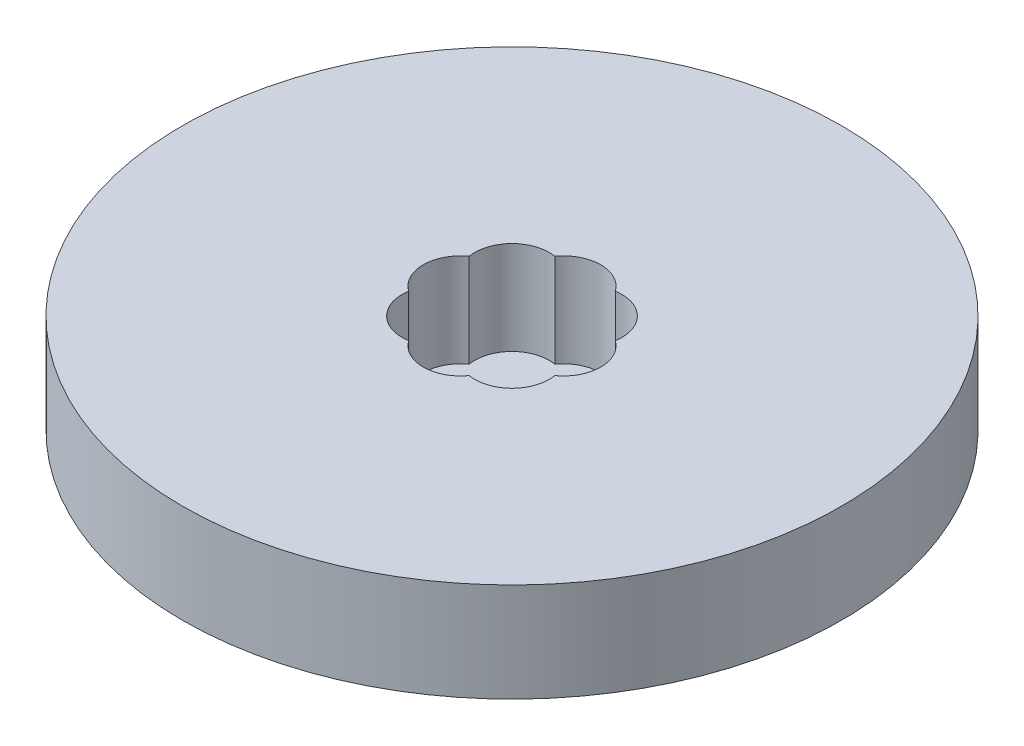
from build123d import *

# Parameters (mm, degrees)
SKETCH1_R           = 80
BOSS_EXTRUDE1_DEPTH = 24
SKETCH2_R           = 7.5
CUT_EXTRUDE1_DEPTH  = 116.654658358
SKETCH3_R           = 9.027109829
CUT_EXTRUDE2_DEPTH  = 22.69175852
CIRPATTERN1_COUNT   = 8


with BuildPart() as part:
    # Sketch1 → Boss-Extrude1 (new body)
    with BuildSketch(Plane(origin=(0, 0, 0), x_dir=(1, 0, 0), z_dir=(0, 1, 0))):
        Circle(SKETCH1_R)
    extrude(amount=BOSS_EXTRUDE1_DEPTH)

    # Sketch2 → Cut-Extrude1 (cut, through all)
    with BuildSketch(Plane(origin=(0, 0, 0), x_dir=(1, 0, 0), z_dir=(0, 1, 0))):
        Circle(SKETCH2_R)
    extrude(amount=CUT_EXTRUDE1_DEPTH, mode=Mode.SUBTRACT)

    # Sketch3 → Cut-Extrude2 (cut)
    with BuildSketch(Plane(origin=(0, 24, 0), x_dir=(1, 0, 0), z_dir=(0, 1, 0))):
        with Locations((-12.499023748, 0)):
            Circle(SKETCH3_R)
    cut_extrude2 = extrude(amount=-CUT_EXTRUDE2_DEPTH, mode=Mode.SUBTRACT)

    # CirPattern1: Cut-Extrude2 ×8 about axis
    cirpattern1_axis = Axis((0, 0, 0), (0, 1, 0))
    for i in range(1, CIRPATTERN1_COUNT):
        add(cut_extrude2.rotate(cirpattern1_axis, i * 360 / CIRPATTERN1_COUNT), mode=Mode.SUBTRACT)


solid = part.part
